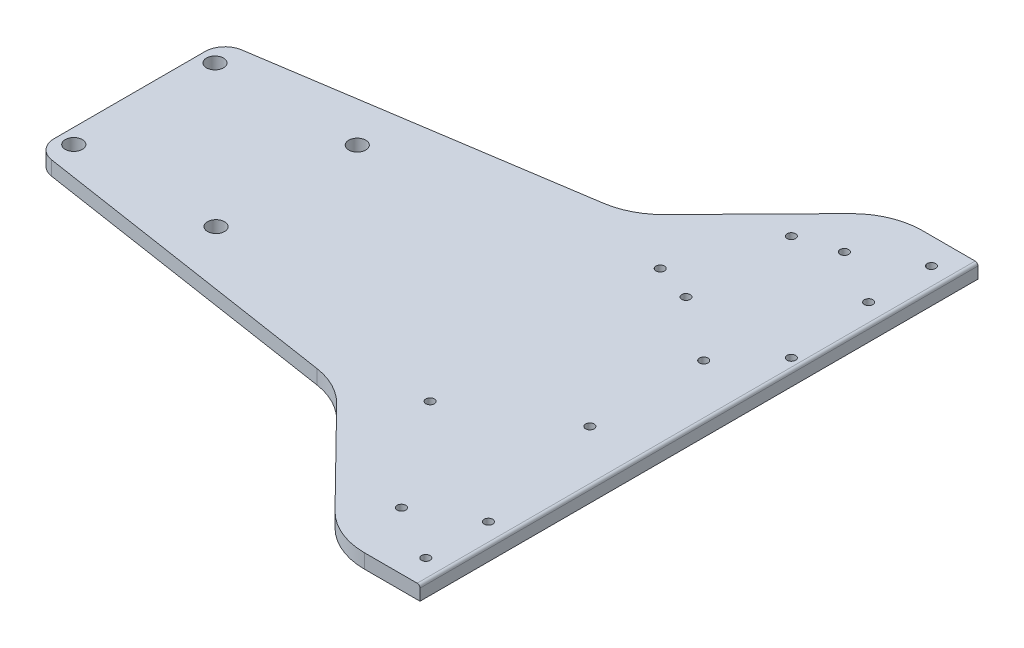
from build123d import *

# Parameters (mm, degrees)
BOSS_EXTRU_1_DEPTH      = 5
CONG_3_R                = 7
ESQUISSE3_R             = 3
ENL_V_MAT_EXTRU_1_DEPTH = 5
CONG_2_R                = 1
ESQUISSE4_R             = 1.503847334
ESQUISSE4_R_2           = 1.498131622
ESQUISSE4_R_3           = 1.50323989
ENL_V_MAT_EXTRU_2_DEPTH = 10
ESQUISSE6_R             = 1.5
ENL_V_MAT_EXTRU_3_DEPTH = 10
ESQUISSE7_R             = 1.5
ENL_V_MAT_EXTRU_4_DEPTH = 10
ESQUISSE8_R             = 1.5
ENL_V_MAT_EXTRU_5_DEPTH = 10


with BuildPart() as part:
    # Esquisse1 → Boss.-Extru.1 (new body)
    with BuildSketch(Plane(origin=(0, 0, 0), x_dir=(1, 0, 0), z_dir=(0, 1, 0))):
        with BuildLine():
            Line((200, 98), (180.486918987, 98))
            ThreePointArc((180.486918987, 98), (170.816361757, 96.053857006), (162.651427502, 90.518425828))
            Line((162.651427502, 90.518425828), (130.227508241, 57.507666668))
            ThreePointArc((130.227508241, 57.507666668), (123.786759953, 52.773905469), (116.181163829, 50.314913559))
            Line((116.181163829, 50.314913559), (0, 32.5))
            Line((0, 32.5), (0, 19.62474242))
            Line((0, 19.62474242), (0, -19.62474242))
            Line((0, -19.62474242), (0, -32.5))
            Line((0, -32.5), (116.181163829, -50.314913559))
            ThreePointArc((116.181163829, -50.314913559), (123.786759953, -52.773905469), (130.227508241, -57.507666668))
            Line((130.227508241, -57.507666668), (162.651427502, -90.518425828))
            ThreePointArc((162.651427502, -90.518425828), (170.816361757, -96.053857006), (180.486918987, -98))
            Line((180.486918987, -98), (200, -98))
            Line((200, -98), (200, 98))
        make_face()
    extrude(amount=BOSS_EXTRU_1_DEPTH)

    # Congé3
    cong_3_edges = [part.edges().sort_by_distance(p)[0] for p in [
        (0, 2.5, 32.5),
        (0, 2.5, -32.5),
    ]]
    fillet(cong_3_edges, radius=CONG_3_R)

    # Esquisse3 → Enlèv. mat.-Extru.1 (cut)
    with BuildSketch(Plane(origin=(0, 5, 0), x_dir=(1, 0, 0), z_dir=(0, 1, 0))):
        with Locations((5.228132429, -24.85729672)):
            Circle(ESQUISSE3_R)
        with Locations((5.228132429, 24.743581245)):
            Circle(ESQUISSE3_R)
        with Locations((55.20842969, -24.85729672)):
            Circle(ESQUISSE3_R)
        with Locations((55.20842969, 24.743581245)):
            Circle(ESQUISSE3_R)
    extrude(amount=-ENL_V_MAT_EXTRU_1_DEPTH, mode=Mode.SUBTRACT)

    # Congé2
    cong_2_edges = [part.edges().sort_by_distance(p)[0] for p in [
        (200, 5, 0),
    ]]
    fillet(cong_2_edges, radius=CONG_2_R)

    # Esquisse4 → Enlèv. mat.-Extru.2 (cut)
    with BuildSketch(Plane(origin=(0, 5, 0), x_dir=(1, 0, 0), z_dir=(0, 1, 0))):
        with Locations((192.801268115, -66.778012946)):
            Circle(ESQUISSE4_R)
        with Locations((192.824609704, -88.804759655)):
            Circle(ESQUISSE4_R_2)
        with Locations((173.269117951, -77.791386301)):
            Circle(ESQUISSE4_R_3)
        with Locations((173.269117951, 77.791386301)):
            Circle(ESQUISSE4_R_3)
        with Locations((192.824609704, 88.804759655)):
            Circle(ESQUISSE4_R_2)
        with Locations((192.801268115, 66.778012946)):
            Circle(ESQUISSE4_R)
    extrude(amount=-ENL_V_MAT_EXTRU_2_DEPTH, mode=Mode.SUBTRACT)

    # Esquisse6 → Enlèv. mat.-Extru.3 (cut)
    with BuildSketch(Plane(origin=(0, 5, 0), x_dir=(1, 0, 0), z_dir=(0, 1, 0))):
        with Locations((181.582963716, 20.060076368)):
            Circle(ESQUISSE6_R)
        with Locations((181.63025752, -19.977667143)):
            Circle(ESQUISSE6_R)
    extrude(amount=-ENL_V_MAT_EXTRU_3_DEPTH, mode=Mode.SUBTRACT)

    # Esquisse7 → Enlèv. mat.-Extru.4 (cut)
    with BuildSketch(Plane(origin=(0, 5, 0), x_dir=(1, 0, 0), z_dir=(0, 1, 0))):
        with Locations((145.949264841, 40.414479314)):
            Circle(ESQUISSE7_R)
        with Locations((145.949264841, -40.414479314)):
            Circle(ESQUISSE7_R)
    extrude(amount=-ENL_V_MAT_EXTRU_4_DEPTH, mode=Mode.SUBTRACT)

    # Esquisse8 → Enlèv. mat.-Extru.5 (cut)
    with BuildSketch(Plane(origin=(0, 5, 0), x_dir=(1, 0, 0), z_dir=(0, 1, 0))):
        with Locations((196.148923391, 36.274574464)):
            Circle(ESQUISSE8_R)
        with Locations((159.148923391, 73.274574464)):
            Circle(ESQUISSE8_R)
        with Locations((159.148923391, 36.274574464)):
            Circle(ESQUISSE8_R)
    extrude(amount=-ENL_V_MAT_EXTRU_5_DEPTH, mode=Mode.SUBTRACT)


solid = part.part
